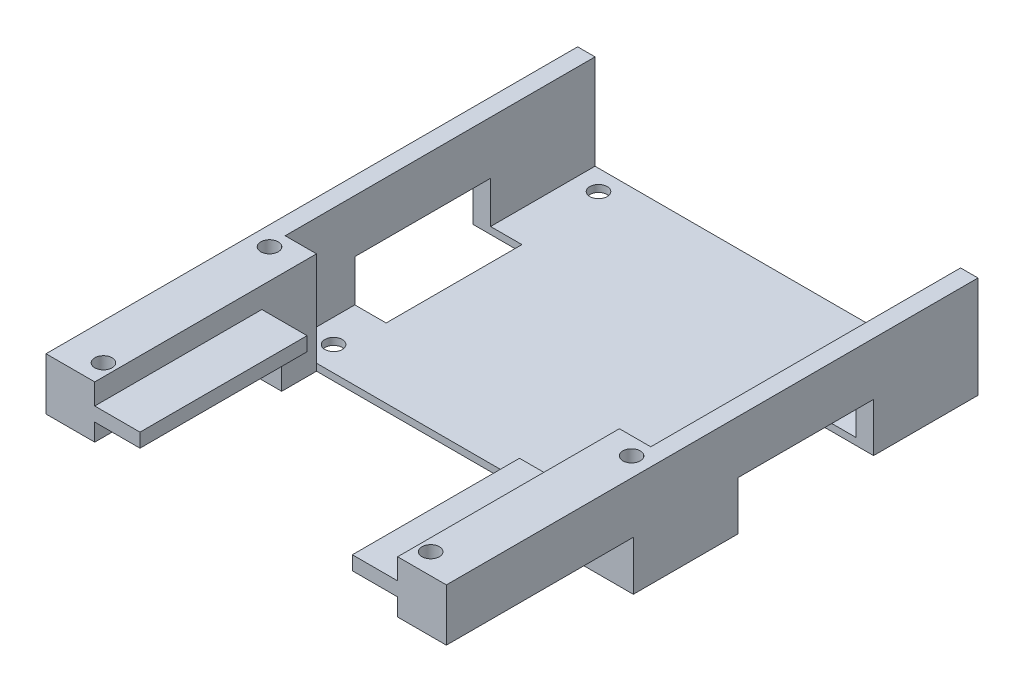
from build123d import *

# Parameters (mm, degrees)
SKETCH1_W                  = 52.5
SKETCH1_H                  = 44.5
BOSS_EXTRUDE1_DEPTH        = 1
BOSS_EXTRUDE2_DEPTH        = 14.6
F_2_5_2_5_DIAMETER_HOLE1_D = 2.5
SKETCH6_W                  = 6.5
SKETCH6_H                  = 2
BOSS_EXTRUDE3_DEPTH        = 24
SKETCH6_4_W                = 7
SKETCH6_4_H                = 7.1
CUT_EXTRUDE1_DEPTH         = 26.85
SKETCH8_W                  = 7
SKETCH8_H                  = 19.5
CUT_EXTRUDE2_DEPTH         = 7
CUT_EXTRUDE3_DEPTH         = 0.1


with BuildPart() as part:
    # Sketch1 → Boss-Extrude1 (new body)
    with BuildSketch(Plane(origin=(0, 0, 0), x_dir=(1, 0, 0), z_dir=(0, 1, 0))):
        with Locations((0, 54.1)):
            Rectangle(SKETCH1_W, SKETCH1_H)
    extrude(amount=BOSS_EXTRUDE1_DEPTH)

    # Sketch1<3> → Boss-Extrude2 (add)
    with BuildSketch(Plane(origin=(0, 0, 0), x_dir=(1, 0, 0), z_dir=(0, 1, 0))):
        Polygon((-26.25, 76.35), (-28.75, 76.35), (-28.75, 0), (-21.75, 0), (-21.75, 31.85), (-26.25, 31.85), align=None)
        Polygon((28.75, 76.35), (26.25, 76.35), (26.25, 31.85), (21.75, 31.85), (21.75, 0), (28.75, 0), align=None)
    extrude(amount=BOSS_EXTRUDE2_DEPTH)

    # Ø2.5 (2.5) Diameter Hole1 (through all)
    with Locations(Plane(origin=(0, 0, 0), x_dir=(-1, 0, 0), z_dir=(0, -1, 0))):
        with Locations((-22.85, 73.45), (22.85, 73.45), (26, 29.35), (22.85, 35.4), (-22.85, 35.4), (-26, 29.35), (-23.5, 3), (23.5, 3), (-30.25, 71.35), (30.25, 71.35)):
            Hole(F_2_5_2_5_DIAMETER_HOLE1_D / 2)

    # Sketch6 → Boss-Extrude3 (add)
    with BuildSketch(Plane.XY):
        with Locations((-18.5, 10.6)):
            Rectangle(SKETCH6_W, SKETCH6_H)
        with Locations((18.5, 10.6)):
            Rectangle(SKETCH6_W, SKETCH6_H)
    extrude(amount=-BOSS_EXTRUDE3_DEPTH)

    # Sketch6<4> → Cut-Extrude1 (cut)
    with BuildSketch(Plane.XY):
        with Locations((-25.25, 3.55)):
            Rectangle(SKETCH6_4_W, SKETCH6_4_H)
        with Locations((25.25, 3.55)):
            Rectangle(SKETCH6_4_W, SKETCH6_4_H)
    extrude(amount=-CUT_EXTRUDE1_DEPTH, mode=Mode.SUBTRACT)

    # Sketch8 → Cut-Extrude2 (cut)
    with BuildSketch(Plane.XZ):
        with Locations((-25.25, -51.6)):
            Rectangle(SKETCH8_W, SKETCH8_H)
        with Locations((25.25, -51.6)):
            Rectangle(SKETCH8_W, SKETCH8_H)
    extrude(amount=-CUT_EXTRUDE2_DEPTH, mode=Mode.SUBTRACT)

    # Sketch9 → Cut-Extrude3 (cut)
    with BuildSketch(Plane.XZ):
        Polygon((-3.689843301, -66.963585904), (-0.766939618, -56.191794443), (-9.599348257, -56.191794443), (4.207929605, -40.061796941), (3.001024061, -51.044637389), (10.995078197, -51.044637389), align=None)
    extrude(amount=-CUT_EXTRUDE3_DEPTH, mode=Mode.SUBTRACT)


solid = part.part
